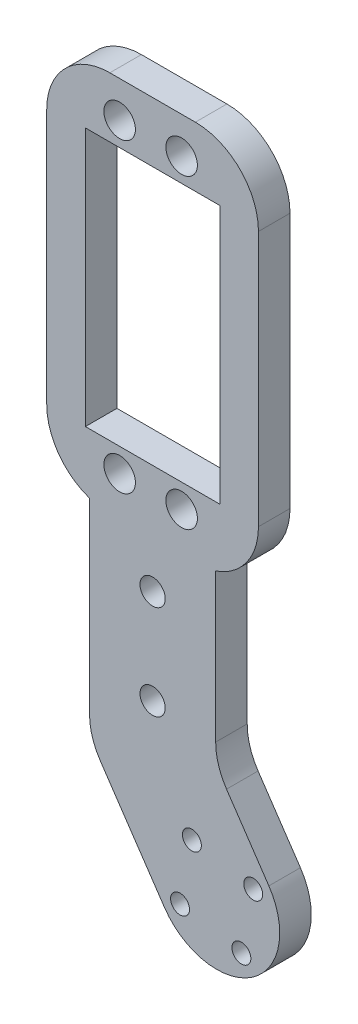
from build123d import *

# Parameters (mm, degrees)
BOSS_EXTRUDE1_DEPTH = 5
SKETCH4_W           = 33.55861501
SKETCH4_H           = 60
BOSS_EXTRUDE2_DEPTH = 5
SKETCH3_R           = 2.5
SKETCH3_W           = 21.3
SKETCH3_H           = 41
CUT_EXTRUDE1_DEPTH  = 5
FILLET1_R           = 10
SKETCH2_R           = 1.5
SKETCH2_R_2         = 2
CUT_EXTRUDE2_DEPTH  = 5
FILLET2_R           = 10


with BuildPart() as part:
    # Sketch1 → Boss-Extrude1 (new body)
    with BuildSketch(Plane.XY):
        with BuildLine():
            Line((-20.15, 104.620325978), (-20.15, 11.934589711))
            Line((-20.15, 11.934589711), (-8.282080395, -5.604207734))
            ThreePointArc((-8.282080395, -5.604207734), (-4.754289632, -8.797541139), (-0.15, -9.998874937))
            ThreePointArc((-0.15, -9.998874937), (8.797541139, -4.754289632), (8.282080395, 5.604207734))
            Line((8.282080395, 5.604207734), (-0.15, 18.065410289))
            Line((-0.15, 18.065410289), (-0.15, 104.620325978))
            Line((-0.15, 104.620325978), (-20.15, 104.620325978))
        make_face()
    extrude(amount=BOSS_EXTRUDE1_DEPTH)

    # Sketch4 → Boss-Extrude2 (add)
    with BuildSketch(Plane.XY.offset(5)):
        with Locations((-10.15, 74.620325978)):
            Rectangle(SKETCH4_W, SKETCH4_H)
    extrude(amount=-BOSS_EXTRUDE2_DEPTH)

    # Sketch3 → Cut-Extrude1 (cut)
    with BuildSketch(Plane.XY.offset(5)):
        with Locations((-5.55, 50.370325978)):
            Circle(SKETCH3_R)
        with Locations((-15.37372371, 50.370325978)):
            Circle(SKETCH3_R)
        with Locations((-15.37372371, 98.870325978)):
            Circle(SKETCH3_R)
        with Locations((-5.55, 98.870325978)):
            Circle(SKETCH3_R)
        with Locations((-10.15, 74.620325978)):
            Rectangle(SKETCH3_W, SKETCH3_H)
    extrude(amount=-CUT_EXTRUDE1_DEPTH, mode=Mode.SUBTRACT)

    # Fillet1
    # the kernel refuses this fillet: 10 mm, written as the material it takes off along each edge
    with BuildSketch(Plane(origin=(-26.929307505, 104.620325978, 30), x_dir=(1, 0, 0), z_dir=(0, 0, -1))) as fillet1_piece_1:
        with BuildLine():
            CenterArc((FILLET1_R, FILLET1_R), FILLET1_R, 180, 90)
            Line((0, FILLET1_R), (-FILLET1_R * 0.02, FILLET1_R))
            Line((-FILLET1_R * 0.02, FILLET1_R), (-FILLET1_R * 0.02, -FILLET1_R * 0.02))
            Line((-FILLET1_R * 0.02, -FILLET1_R * 0.02), (FILLET1_R, -FILLET1_R * 0.02))
            Line((FILLET1_R, -FILLET1_R * 0.02), (FILLET1_R, 0))
        make_face()
    extrude(amount=55, mode=Mode.SUBTRACT)
    with BuildSketch(Plane(origin=(6.629307505, 104.620325978, 30), x_dir=(-1, 0, 0), z_dir=(0, 0, -1))) as fillet1_piece_2:
        with BuildLine():
            CenterArc((FILLET1_R, -FILLET1_R), FILLET1_R, 90, 90)
            Line((0, -FILLET1_R), (-FILLET1_R * 0.02, -FILLET1_R))
            Line((-FILLET1_R * 0.02, -FILLET1_R), (-FILLET1_R * 0.02, FILLET1_R * 0.02))
            Line((-FILLET1_R * 0.02, FILLET1_R * 0.02), (FILLET1_R, FILLET1_R * 0.02))
            Line((FILLET1_R, FILLET1_R * 0.02), (FILLET1_R, 0))
        make_face()
    extrude(amount=55, mode=Mode.SUBTRACT)
    with BuildSketch(Plane(origin=(6.629307505, 44.620325978, 28.667902824), x_dir=(0, 1, 0), z_dir=(0, 0, -1))) as fillet1_piece_3:
        with BuildLine():
            CenterArc((9.46716113, -10), FILLET1_R, 90, 71.211889426)
            Line((0, -6.779307505), (-0.189343223, -6.714893655))
            ThreePointArc((-0.189343223, -6.714893655), (-0.2, -3.389653753), (-0.2, 0))
            Line((-0.2, 0), (0, 0.2))
            Line((0, 0.2), (9.46716113, 0.2))
            Line((9.46716113, 0.2), (9.46716113, 0))
        make_face()
    extrude(amount=52.335805648, mode=Mode.SUBTRACT)
    with BuildSketch(Plane(origin=(-26.929307505, 44.620325978, 28.667902824), x_dir=(0, 1, 0), z_dir=(0, 0, -1))) as fillet1_piece_4:
        with BuildLine():
            CenterArc((9.46716113, 10), FILLET1_R, 198.788110574, 71.211889426)
            Line((0, 6.779307505), (-0.189343223, 6.714893655))
            ThreePointArc((-0.189343223, 6.714893655), (-0.2, 3.389653753), (-0.2, 0))
            Line((-0.2, 0), (0, -0.2))
            Line((0, -0.2), (9.46716113, -0.2))
            Line((9.46716113, -0.2), (9.46716113, 0))
        make_face()
    extrude(amount=52.335805648, mode=Mode.SUBTRACT)

    # Sketch2 → Cut-Extrude2 (cut)
    with BuildSketch(Plane.XY.offset(5)):
        with Locations((-3.922945414, 5.797456277)):
            Circle(SKETCH2_R)
        with Locations((5.797456277, 3.922945414)):
            Circle(SKETCH2_R)
        with Locations((3.922945414, -5.797456277)):
            Circle(SKETCH2_R)
        with Locations((-5.797456277, -3.922945414)):
            Circle(SKETCH2_R)
        with Locations((-10.15, 21.797456277)):
            Circle(SKETCH2_R_2)
        with Locations((-10.15, 36.797456277)):
            Circle(SKETCH2_R_2)
    extrude(amount=-CUT_EXTRUDE2_DEPTH, mode=Mode.SUBTRACT)

    # Fillet2
    fillet2_edges = [part.edges().sort_by_distance(p)[0] for p in [
        (-20.15, 11.934589711, 2.5),
        (-0.15, 18.065410289, 2.5),
    ]]
    fillet(fillet2_edges, radius=FILLET2_R)


solid = part.part
